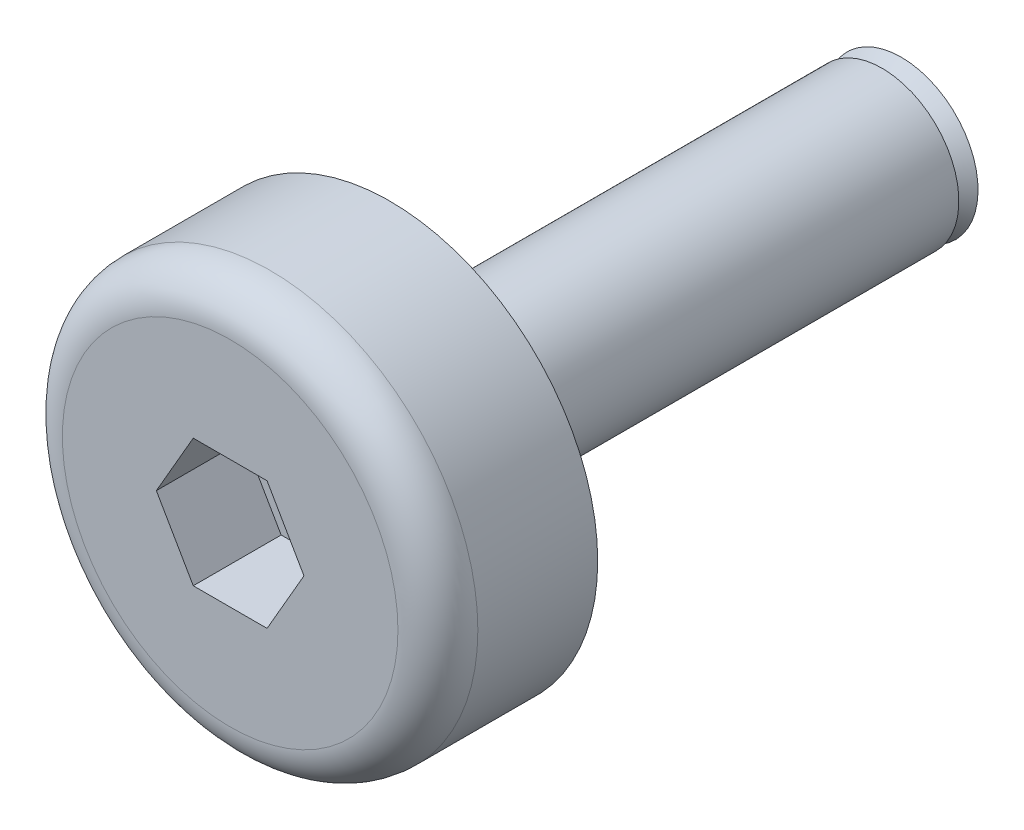
from build123d import *

# Parameters (mm, degrees)
F_0000_CYLINDER_SKETCH_R    = 3.25
F_0000_CYLINDER_DEPTH       = 2.5
F_0001_FILLET_R             = 0.625
F_0002_EXTRUDE_DEPTH        = 1.385
F_0002_EXTRUDE_ROTATE_ANGLE = 120
F_0005_CYLINDER_SKETCH_R    = 1.2
F_0005_CYLINDER_DEPTH       = 7.7
F_0006_CONE_ROTATE_ANGLE    = 90


with BuildPart() as part:
    # 0000_cylinder_Sketch → 0000_cylinder (new body)
    with BuildSketch(Plane.XY):
        Circle(F_0000_CYLINDER_SKETCH_R)
    extrude(amount=F_0000_CYLINDER_DEPTH)

    # 0001_fillet
    f_0001_fillet_edges = [part.edges().sort_by_distance(p)[0] for p in [
        (-3.25, 0, 2.5),
    ]]
    fillet(f_0001_fillet_edges, radius=F_0001_FILLET_R)


with BuildPart() as body_2:
    # 0002_extrude_Sketch → 0002_extrude (new body)
    with BuildSketch(Plane.XY):
        Polygon((0, 0), (1.154700538, 0), (1.732050808, 1), (1.154700538, 2), (0, 2), (-0.577350269, 1), align=None)
    extrude(amount=F_0002_EXTRUDE_DEPTH)


with BuildPart() as body_2_1:
    # 0002_extrude_Rotate: read off the stored shape, not the designer's step
    # 0002_extrude_Rotate: moved
    add(body_2.part.rotate(Axis((0, 0, 0), (0, 0, 1)), F_0002_EXTRUDE_ROTATE_ANGLE))


with BuildPart() as body_2_2:
    # 0002_extrude_Translate: moved
    add(body_2_1.part.moved(Location((1.154700538, 0, 1.125))))


with BuildPart() as part_1:
    add(part.part)

    # 0004_sub: cut body 2
    add(body_2_2.part, mode=Mode.SUBTRACT)


with BuildPart() as body_2_2_1:
    # 0005_cylinder_Sketch → 0005_cylinder (new body)
    with BuildSketch(Plane.XY):
        with Locations(Location((0, 0, 0), (0, 0, 180))):
            Circle(F_0005_CYLINDER_SKETCH_R)
    extrude(amount=F_0005_CYLINDER_DEPTH)


with BuildPart() as body_2_2_2:
    # 0005_cylinder_Translate: moved
    add(body_2_2_1.part.moved(Location((0, 0, -7.7))))


with BuildPart() as body_3:
    # 0006_cone_Sketch → 0006_cone (revolve)
    with BuildSketch(Plane.XY, mode=Mode.PRIVATE) as f_0006_cone_sk:
        Polygon((0, 0), (1.2, 0), (0.9, 0.3), (0, 0.3), align=None)
    revolve(f_0006_cone_sk.sketch.rotate(Axis((0, -100, 0), (0, 1, 0)), 90), axis=Axis((0, -100, 0), (0, 1, 0)))


with BuildPart() as body_3_1:
    # 0006_cone_Rotate: moved
    add(body_3.part.rotate(Axis((0, 0, 0), (1, 0, 0)), F_0006_CONE_ROTATE_ANGLE))


with BuildPart() as body_3_2:
    # 0006_cone_Translate: moved
    add(body_3_1.part.moved(Location((0, 0, -8))))


with BuildPart() as body_2_2_3:
    add(body_2_2_2.part)

    # 0008_add: union body 3
    add(body_3_2.part)


with BuildPart() as part_2:
    add(part_1.part)

    # 0009_add: union body 2 2
    add(body_2_2_3.part)


solid = part_2.part
